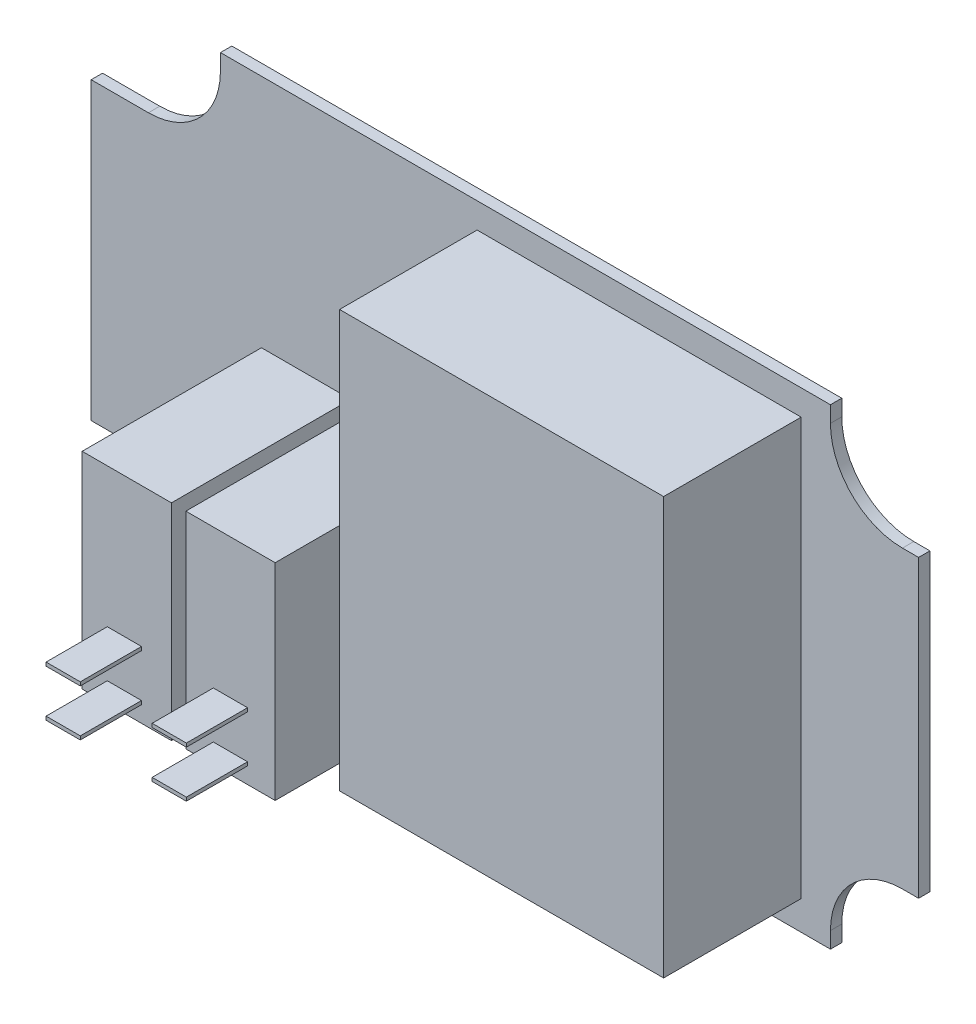
from build123d import *

# Parameters (mm, degrees)
BOSS_EXTRUDE1_DEPTH = 1.5748
SKETCH2_W           = 12.4
SKETCH2_H           = 28.6
BOSS_EXTRUDE2_DEPTH = 24.9
SKETCH3_W           = 4.75
SKETCH3_H           = 0.5
BOSS_EXTRUDE3_DEPTH = 8.5
SKETCH4_W           = 45
SKETCH4_H           = 57.9
BOSS_EXTRUDE4_DEPTH = 19.1


with BuildPart() as part:
    # Sketch1 → Boss-Extrude1 (new body)
    with BuildSketch(Plane.XY):
        with BuildLine():
            Line((42.354093023, -30.703264053), (42.354093023, -32.943264053))
            Line((42.354093023, -32.943264053), (-42.354093023, -32.943264053))
            Line((-42.354093023, -32.943264053), (-42.354093023, -30.703264053))
            ThreePointArc((-42.354093023, -30.703264053), (-45.283025211, -23.632196241), (-52.354093023, -20.703264053))
            Line((-52.354093023, -20.703264053), (-60.301272865, -20.703264053))
            Line((-60.301272865, -20.703264053), (-60.301272865, 20.296735947))
            Line((-60.301272865, 20.296735947), (-52.354093023, 20.296735947))
            ThreePointArc((-52.354093023, 20.296735947), (-45.283025211, 23.225668135), (-42.354093023, 30.296735947))
            Line((-42.354093023, 30.296735947), (-42.354093023, 32.536735947))
            Line((-42.354093023, 32.536735947), (42.354093023, 32.536735947))
            Line((42.354093023, 32.536735947), (42.354093023, 30.296735947))
            ThreePointArc((42.354093023, 30.296735947), (45.283025211, 23.225668135), (52.354093023, 20.296735947))
            Line((52.354093023, 20.296735947), (54.593335979, 20.296735947))
            Line((54.593335979, 20.296735947), (54.593335979, -20.703264053))
            Line((54.593335979, -20.703264053), (52.354093023, -20.703264053))
            ThreePointArc((52.354093023, -20.703264053), (45.283025211, -23.632196241), (42.354093023, -30.703264053))
        make_face()
    extrude(amount=BOSS_EXTRUDE1_DEPTH)

    # Sketch2 → Boss-Extrude2 (add)
    with BuildSketch(Plane.XY.offset(1.5748)):
        with Locations((-30.457181744, -14.416216189)):
            Rectangle(SKETCH2_W, SKETCH2_H)
        with Locations((-16.057181744, -14.416216189)):
            Rectangle(SKETCH2_W, SKETCH2_H)
    extrude(amount=BOSS_EXTRUDE2_DEPTH)

    # Sketch3 → Boss-Extrude3 (add)
    with BuildSketch(Plane.XY.offset(26.4748)):
        with Locations((-16.064182879, -26.220731539)):
            Rectangle(SKETCH3_W, SKETCH3_H)
        with Locations((-16.064182879, -19.720731539)):
            Rectangle(SKETCH3_W, SKETCH3_H)
        with Locations((-30.792693371, -26.220731539)):
            Rectangle(SKETCH3_W, SKETCH3_H)
        with Locations((-30.792693371, -19.720731539)):
            Rectangle(SKETCH3_W, SKETCH3_H)
    extrude(amount=BOSS_EXTRUDE3_DEPTH)

    # Sketch4 → Boss-Extrude4 (add)
    with BuildSketch(Plane.XY.offset(1.5748)):
        with Locations((15.786645431, 0.061567403)):
            Rectangle(SKETCH4_W, SKETCH4_H)
    extrude(amount=BOSS_EXTRUDE4_DEPTH)


solid = part.part
